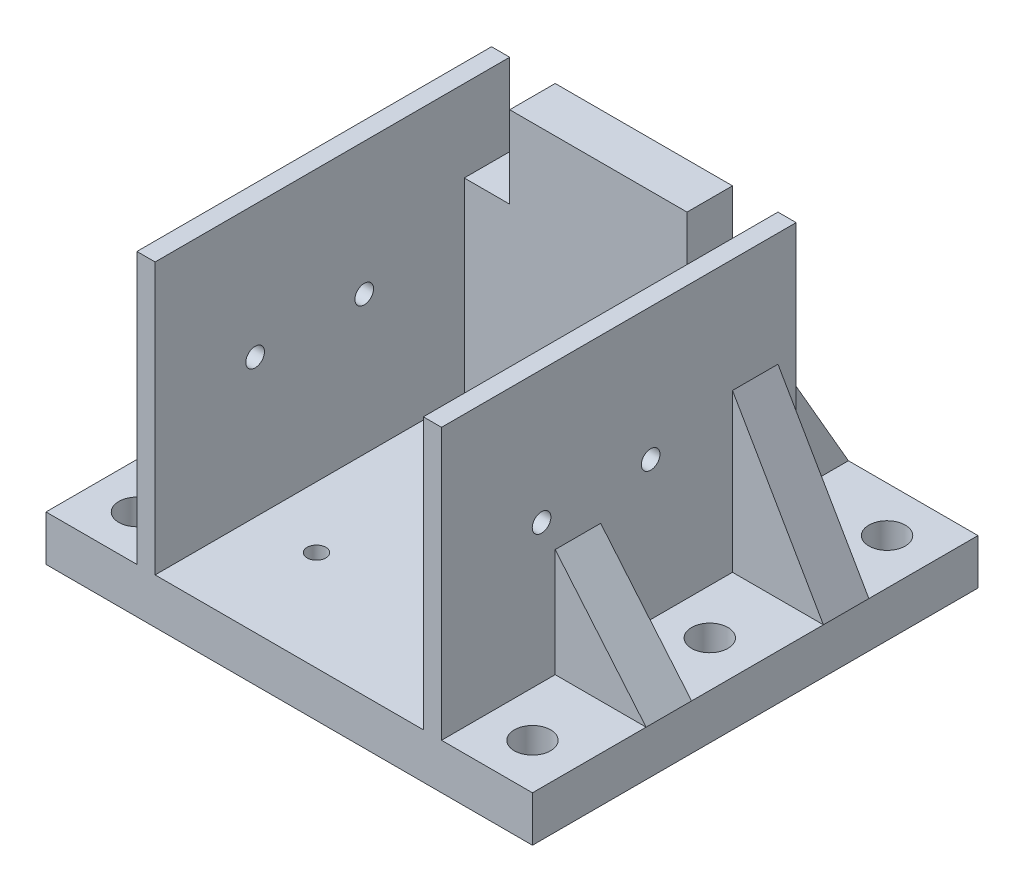
from build123d import *

# Parameters (mm, degrees)
ESQUISSE1_W             = 33.5
ESQUISSE1_H             = 39
BOSS_EXTRU_1_DEPTH      = 49
ESQUISSE3_W             = 29.5
ESQUISSE3_H             = 44
ENL_V_MAT_EXTRU_1_DEPTH = 34
ESQUISSE4_W             = 53.5
ESQUISSE4_H             = 49
BOSS_EXTRU_2_DEPTH      = 5
ESQUISSE5_R             = 2
ENL_V_MAT_EXTRU_2_DEPTH = 5
NERVURE3_REACH          = 67.365
ESQUISSE8_WALL_W        = 148.286921202
ESQUISSE8_WALL_H        = 5
NERVURE4_REACH          = 67.626
ESQUISSE9_WALL_W        = 153.252619022
ESQUISSE9_WALL_H        = 5
NERVURE5_REACH          = 69.984
ESQUISSE10_WALL_W       = 157.967827076
ESQUISSE10_WALL_H       = 5
ESQUISSE11_R            = 1.025
ENL_V_MAT_EXTRU_3_DEPTH = 5
ESQUISSE13_W            = 39
ESQUISSE13_H            = 14.190780958
ENL_V_MAT_EXTRU_5_DEPTH = 72.857497869
SYM_TRIE6_START         = 25.809219042
SYM_TRIE6_OUTLINE_W     = 5
SYM_TRIE6_OUTLINE_H     = 5
SYM_TRIE6_DEPTH         = 9
SYM_TRIE6_2_OUTLINE_R   = 3
SYM_TRIE6_2_DEPTH       = 3
SYM_TRIE6_START_2       = 3
SYM_TRIE6_3_OUTLINE_R   = 1.025
SYM_TRIE6_3_DEPTH       = 2


# Read off the part's stored shape, not the designer's step: Symétrie6
with BuildPart() as part:
    # Esquisse1 → Boss.-Extru.1 (new body)
    with BuildSketch(Plane(origin=(0, 0, 0), x_dir=(1, 0, 0), z_dir=(0, 1, 0))):
        Rectangle(ESQUISSE1_W, ESQUISSE1_H)
    extrude(amount=BOSS_EXTRU_1_DEPTH)

    # Esquisse3 → Enlèv. mat.-Extru.1 (cut)
    with BuildSketch(Plane.XY.offset(19.5)):
        with Locations((0, 27)):
            Rectangle(ESQUISSE3_W, ESQUISSE3_H)
    extrude(amount=-ENL_V_MAT_EXTRU_1_DEPTH, mode=Mode.SUBTRACT)

    # Esquisse4 → Boss.-Extru.2 (add)
    with BuildSketch(Plane(origin=(0, 0, 0), x_dir=(1, 0, 0), z_dir=(0, 1, 0))):
        with Locations((0, 5)):
            Rectangle(ESQUISSE4_W, ESQUISSE4_H)
    extrude(amount=BOSS_EXTRU_2_DEPTH)

    # Esquisse5 → Enlèv. mat.-Extru.2 (cut)
    with BuildSketch(Plane(origin=(0, 5, 0), x_dir=(1, 0, 0), z_dir=(0, 1, 0))):
        with Locations(Location((-21.75, 24.5, 0), (0, 0, 270))):
            Circle(ESQUISSE5_R)
        with Locations(Location((0, 24.5, 0), (0, 0, 270))):
            Circle(ESQUISSE5_R)
        with Locations(Location((21.75, 24.5, 0), (0, 0, 270))):
            Circle(ESQUISSE5_R)
        with Locations(Location((21.75, 5, 0), (0, 0, 270))):
            Circle(ESQUISSE5_R)
        with Locations(Location((21.75, -14.5, 0), (0, 0, 270))):
            Circle(ESQUISSE5_R)
        with Locations(Location((-21.75, -14.5, 0), (0, 0, 270))):
            Circle(ESQUISSE5_R)
        with Locations(Location((-21.75, 5, 0), (0, 0, 270))):
            Circle(ESQUISSE5_R)
    extrude(amount=-ENL_V_MAT_EXTRU_2_DEPTH, mode=Mode.SUBTRACT)

    # Esquisse8 wall → Nervure3 (add, up to next)
    with BuildSketch(Plane(origin=(21.75, 10.958767963, 4.5), x_dir=(-0.642787609685, 0.766044443121, 0), z_dir=(-0.766044443121, -0.642787609685, 0)), mode=Mode.PRIVATE) as nervure3_sk1:
        Rectangle(ESQUISSE8_WALL_W, ESQUISSE8_WALL_H)
    nervure3_tool1 = extrude(nervure3_sk1.sketch, amount=NERVURE3_REACH, mode=Mode.PRIVATE) - part.part
    nervure3 = nervure3_tool1.solids().sort_by_distance((21.75, 10.958767963, 4.5))[0]
    add(nervure3)

    # Esquisse9 wall → Nervure4 (add, up to next)
    with BuildSketch(Plane(origin=(21.75, 13.660254038, -15), x_dir=(-0.499999999993, 0.866025403788, 0), z_dir=(-0.866025403788, -0.499999999993, 0)), mode=Mode.PRIVATE) as nervure4_sk1:
        Rectangle(ESQUISSE9_WALL_W, ESQUISSE9_WALL_H)
    nervure4_tool1 = extrude(nervure4_sk1.sketch, amount=NERVURE4_REACH, mode=Mode.PRIVATE) - part.part
    nervure4 = nervure4_tool1.solids().sort_by_distance((21.75, 13.660254038, -15))[0]
    add(nervure4)

    # Esquisse10 wall → Nervure5 (add, up to next)
    with BuildSketch(Plane(origin=(10, 13.660254038, -24.5), x_dir=(0, 0.866025403788, 0.499999999993), z_dir=(0, -0.499999999993, 0.866025403788)), mode=Mode.PRIVATE) as nervure5_sk1:
        Rectangle(ESQUISSE10_WALL_W, ESQUISSE10_WALL_H)
    nervure5_tool1 = extrude(nervure5_sk1.sketch, amount=NERVURE5_REACH, mode=Mode.PRIVATE) - part.part
    nervure5 = nervure5_tool1.solids().sort_by_distance((10, 13.660254038, -24.5))[0]
    add(nervure5)

    # Symétrie1: Nervure5 across plane
    add(nervure5.mirror(Plane(origin=(0, 0, 0), x_dir=(0, 0, 1), z_dir=(1, 0, 0))))

    # Symétrie3: Nervure3, Nervure4 across plane
    add(nervure3.mirror(Plane(origin=(0, 0, 0), x_dir=(0, 0, 1), z_dir=(1, 0, 0))))
    add(nervure4.mirror(Plane(origin=(0, 0, 0), x_dir=(0, 0, 1), z_dir=(1, 0, 0))))

    # Esquisse11 → Enlèv. mat.-Extru.3 (cut)
    with BuildSketch(Plane.ZY.offset(16.75)):
        with Locations((-3.5, 44.25)):
            Circle(ESQUISSE11_R)
        with Locations((8.5, 44.25)):
            Circle(ESQUISSE11_R)
        with Locations((-3.5, 20.25)):
            Circle(ESQUISSE11_R)
        with Locations((8.5, 20.25)):
            Circle(ESQUISSE11_R)
    enl_v_mat_extru_3 = extrude(amount=-ENL_V_MAT_EXTRU_3_DEPTH, mode=Mode.SUBTRACT)

    # Symétrie4: Enlèv. mat.-Extru.3 across plane
    add(enl_v_mat_extru_3.mirror(Plane(origin=(0, 0, 0), x_dir=(0, 0, 1), z_dir=(1, 0, 0))), mode=Mode.SUBTRACT)

    # Esquisse13 → Enlèv. mat.-Extru.5 (cut, through all)
    with BuildSketch(Plane(origin=(16.75, 0, 0), x_dir=(0, 0, -1), z_dir=(1, 0, 0))):
        with Locations((0, 41.904609521)):
            Rectangle(ESQUISSE13_W, ESQUISSE13_H)
    extrude(amount=-ENL_V_MAT_EXTRU_5_DEPTH, mode=Mode.SUBTRACT)

    # Symétrie6 outline → Symétrie6 (cut)
    with BuildSketch(Plane(origin=(0, 0, 0), x_dir=(1, 0, 0), z_dir=(0, 1, 0)).offset(SYM_TRIE6_START)):
        with Locations((-12.25, 17)):
            Rectangle(SYM_TRIE6_OUTLINE_W, SYM_TRIE6_OUTLINE_H)
        with Locations((12.25, 17)):
            Rectangle(SYM_TRIE6_OUTLINE_W, SYM_TRIE6_OUTLINE_H)
    extrude(amount=SYM_TRIE6_DEPTH, mode=Mode.SUBTRACT)

    # Sym_trie6 2 outline → Sym_trie6 2 (cut)
    with BuildSketch(Plane(origin=(0, 0, 0), x_dir=(1, 0, 0), z_dir=(0, 1, 0))):
        with Locations((8, -8.5)):
            Circle(SYM_TRIE6_2_OUTLINE_R)
        with Locations((-8, -8.5)):
            Circle(SYM_TRIE6_2_OUTLINE_R)
    extrude(amount=SYM_TRIE6_2_DEPTH, mode=Mode.SUBTRACT)

    # Sym_trie6 3 outline → Sym_trie6 3 (cut)
    with BuildSketch(Plane(origin=(0, 0, 0), x_dir=(1, 0, 0), z_dir=(0, 1, 0)).offset(SYM_TRIE6_START_2)):
        with Locations((8, -8.5)):
            Circle(SYM_TRIE6_3_OUTLINE_R)
        with Locations((-8, -8.5)):
            Circle(SYM_TRIE6_3_OUTLINE_R)
    extrude(amount=SYM_TRIE6_3_DEPTH, mode=Mode.SUBTRACT)


solid = part.part
